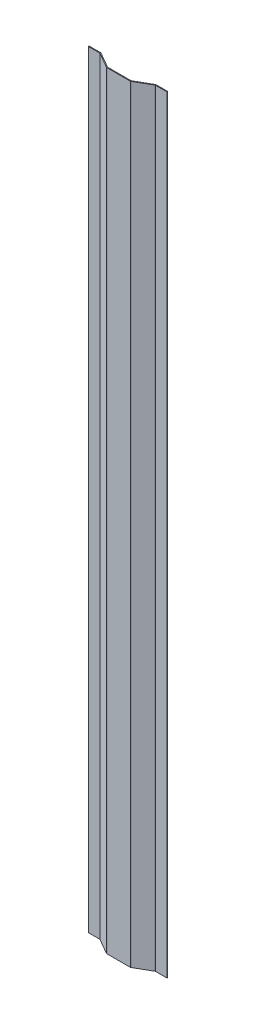
from build123d import *

# Parameters (mm, degrees)
SM_BASE_FLANGE_1_DEPTH = 975


# Sheet-metal steps are written as plain solids
with BuildPart() as part:
    # Sketch 1 → Базовая кромка1 (new body)
    with BuildSketch(Plane(origin=(0, 0, 0), x_dir=(1, 0, 0), z_dir=(0, 1, 0))):
        with BuildLine():
            Line((0, 0), (29.799038106, 0))
            ThreePointArc((29.799038106, 0), (29.99315239, 0.02555563), (30.174038106, 0.100480947))
            Line((30.174038106, 0.100480947), (69.199028853, 22.63156986))
            ThreePointArc((69.199028853, 22.63156986), (69.862276479, 22.906296022), (70.574028853, 23))
            Line((70.574028853, 23), (99.837168574, 23))
            Line((99.837168574, 23), (99.837168574, 21))
            Line((99.837168574, 21), (70.574028853, 21))
            ThreePointArc((70.574028853, 21), (70.379914569, 20.97444437), (70.199028853, 20.899519053))
            Line((70.199028853, 20.899519053), (31.174038106, -1.63156986))
            ThreePointArc((31.174038106, -1.63156986), (30.51079048, -1.906296022), (29.799038106, -2))
            Line((29.799038106, -2), (0, -2))
            Line((0, -2), (0, 0))
        make_face()
    extrude(amount=SM_BASE_FLANGE_1_DEPTH)

    # Зеркальное отражение1: part across plane


with BuildPart() as part_1:
    add(part.part)
    add(part.part.mirror(Plane(origin=(0, 1077.919678531, 2), x_dir=(0, 0, 1), z_dir=(-1, 0, 0))))

    # Зеркальное отражение2: part across plane


with BuildPart() as part_2:
    add(part_1.part)
    add(part_1.part.mirror(Plane(origin=(31, 975, 1.732050808), x_dir=(0, 0, 1), z_dir=(0, 1, 0))))


solid = part_2.part
